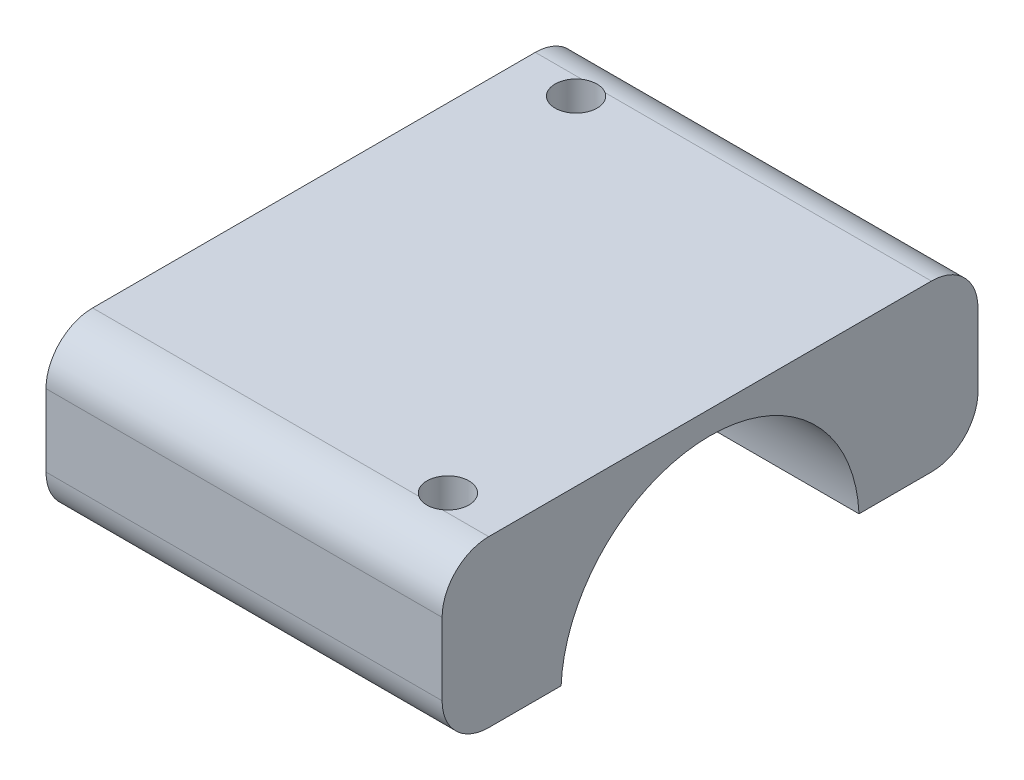
from build123d import *

# Parameters (mm, degrees)
BOSS_EXTRUDE1_DEPTH     = 17
CUT_EXTRUDE1_DEPTH      = 33.20310544
CUT_EXTRUDE1_DEPTH_BACK = 33.20310544
SKETCH2_R               = 12.8
SKETCH3_R               = 1.8
CUT_EXTRUDE2_DEPTH      = 14.8


with BuildPart() as part:
    # Sketch1 → Boss-Extrude1 (new, symmetric)
    with BuildSketch(Plane(origin=(0, 0, 0), x_dir=(0, 0, -1), z_dir=(1, 0, 0))):
        with BuildLine():
            Line((-19, 0.6), (19, 0.6))
            ThreePointArc((19, 0.6), (21.828427125, 1.771572875), (23, 4.6))
            Line((23, 4.6), (23, 10.8))
            ThreePointArc((23, 10.8), (21.828427125, 13.628427125), (19, 14.8))
            Line((19, 14.8), (-19, 14.8))
            ThreePointArc((-19, 14.8), (-21.828427125, 13.628427125), (-23, 10.8))
            Line((-23, 10.8), (-23, 4.6))
            ThreePointArc((-23, 4.6), (-21.828427125, 1.771572875), (-19, 0.6))
        make_face()
    extrude(amount=BOSS_EXTRUDE1_DEPTH, both=True)

    # Sketch2 → Cut-Extrude1 (cut, two sides: drawn at the far end of the back side and taken through both)
    with BuildSketch(Plane(origin=(0, 0, 0), x_dir=(0, 0, -1), z_dir=(1, 0, 0)).offset(-CUT_EXTRUDE1_DEPTH_BACK)):
        Circle(SKETCH2_R)
    extrude(amount=CUT_EXTRUDE1_DEPTH + CUT_EXTRUDE1_DEPTH_BACK, mode=Mode.SUBTRACT)

    # Sketch3 → Cut-Extrude2 (cut)
    with BuildSketch(Plane(origin=(0, 0.6, 0), x_dir=(1, 0, 0), z_dir=(0, 1, 0))):
        with Locations((12, -17.5)):
            Circle(SKETCH3_R)
        with Locations((-12, 17.5)):
            Circle(SKETCH3_R)
    extrude(amount=CUT_EXTRUDE2_DEPTH, mode=Mode.SUBTRACT)


solid = part.part
